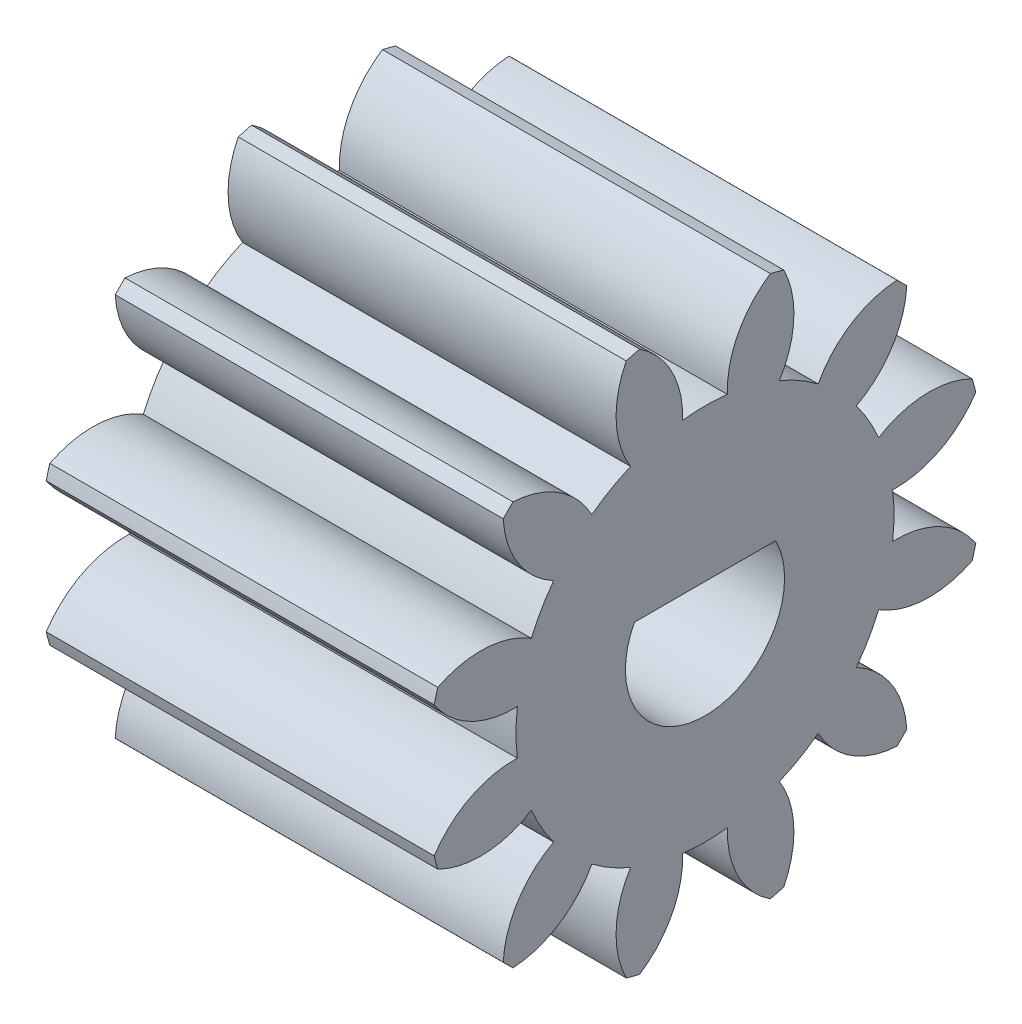
from build123d import *

# Parameters (mm, degrees)
BASPROSKE_W        = 9.75
BASPROSKE_H        = 7
TOOTHCUT_DEPTH     = 14.894693232
TEETHCUTS_COUNT    = 12
TEETHCUTS_ANGLE    = 330
BORSKE_R           = 0.4
BORE_DEPTH         = 50.00129032
SCALE1_SCALE       = 2
CUT_EXTRUDE1_DEPTH = 15
CUT_EXTRUDE2_START = -5
SKETCH5_R          = 4
CUT_EXTRUDE2_DEPTH = 5


with BuildPart() as part:
    # BasProSke → Base-Revolve (revolve)
    with BuildSketch(Plane(origin=(0, 0, 0), x_dir=(1, 0, 0), z_dir=(0, 1, 0))):
        with Locations((4.875, 3.5)):
            Rectangle(BASPROSKE_W, BASPROSKE_H)
    revolve(axis=Axis((-10, 0, 0), (1, 0, 0)))

    # TooCutSke → ToothCut (cut, through all)
    with BuildSketch(Plane(origin=(0, 0, 0), x_dir=(0, 0, -1), z_dir=(1, 0, 0))):
        with BuildLine():
            ThreePointArc((0.562207301, 4.715604304), (0, 4.749), (-0.562207301, 4.715604304))
            ThreePointArc((-0.562207301, 4.715604304), (-1.125816553, 6.345077054), (-2.636485794, 7.176169875))
            ThreePointArc((-2.636485794, 7.176169875), (0, 7.64516), (2.636485794, 7.176169875))
            ThreePointArc((2.636485794, 7.176169875), (1.125816553, 6.345077054), (0.562207301, 4.715604304))
        make_face()
    toothcut = extrude(amount=TOOTHCUT_DEPTH, mode=Mode.SUBTRACT)

    # TeethCuts: ToothCut ×12 about axis
    teethcuts_axis = Axis((-10, 0, 0), (1, 0, 0))
    for i in range(1, TEETHCUTS_COUNT):
        add(toothcut.rotate(teethcuts_axis, i * TEETHCUTS_ANGLE / (TEETHCUTS_COUNT - 1)), mode=Mode.SUBTRACT)

    # BorSke → Bore (cut, symmetric)
    with BuildSketch(Plane(origin=(0, 0, 0), x_dir=(0, 0, -1), z_dir=(1, 0, 0))):
        Circle(BORSKE_R)
    extrude(amount=BORE_DEPTH, both=True, mode=Mode.SUBTRACT)


with BuildPart() as part_1:
    # Scale1: scaled about (4.875, 0, 0)
    add(part.part.scale(SCALE1_SCALE).moved(Location((-4.875, 0, 0))))

    # Sketch4 → Cut-Extrude1 (cut)
    with BuildSketch(Plane(origin=(14.625, 0, 0), x_dir=(0, 0, -1), z_dir=(1, 0, 0))):
        with BuildLine():
            Line((0, 1.85), (-3.546477125, 1.85))
            ThreePointArc((-3.546477125, 1.85), (0, -4), (3.546477125, 1.85))
            Line((3.546477125, 1.85), (0, 1.85))
        make_face()
    extrude(amount=-CUT_EXTRUDE1_DEPTH, mode=Mode.SUBTRACT)

    # Sketch5 → Cut-Extrude2 (cut)
    with BuildSketch(Plane.ZY.offset(4.875).offset(CUT_EXTRUDE2_START)):
        Circle(SKETCH5_R)
    extrude(amount=CUT_EXTRUDE2_DEPTH, mode=Mode.SUBTRACT)


solid = part_1.part
